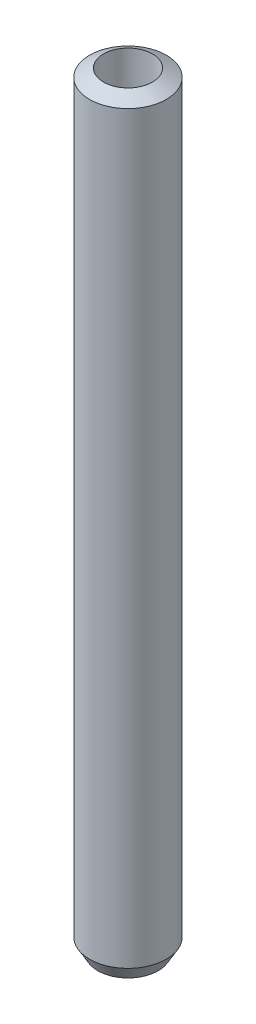
from build123d import *

# Parameters (mm, degrees)
SKETCH1_R           = 15
BOSS_EXTRUDE1_DEPTH = 299.717101
SKETCH2_R           = 9.555575494
CUT_EXTRUDE1_DEPTH  = 301.466871105
CHAMFER1_SIZE       = 3.18615
CHAMFER1_SIZE_2     = 5.518573


with BuildPart() as part:
    # Sketch1 → Boss-Extrude1 (new body)
    with BuildSketch(Plane(origin=(0, 0, 0), x_dir=(1, 0, 0), z_dir=(0, 1, 0))):
        with Locations(Location((0, 0, 0), (0, 0, 270))):
            Circle(SKETCH1_R)
    extrude(amount=BOSS_EXTRUDE1_DEPTH)

    # Sketch2 → Cut-Extrude1 (cut, through all)
    with BuildSketch(Plane(origin=(0, 0, 0), x_dir=(1, 0, 0), z_dir=(0, 1, 0))):
        with Locations(Location((0, 0, 0), (0, 0, 270))):
            Circle(SKETCH2_R)
    extrude(amount=CUT_EXTRUDE1_DEPTH, mode=Mode.SUBTRACT)

    # Chamfer1
    # the kernel refuses this chamfer: 5.518573, 3.18615 mm, written as the material it takes off along each edge
    with BuildSketch(Plane(origin=(0, 299.717101, 0), x_dir=(0, 0, 1), z_dir=(-1, 0, 0))) as chamfer1_piece_1:
        Polygon((15, -CHAMFER1_SIZE), (15 - CHAMFER1_SIZE_2, 0), (15, 0), align=None)
    revolve(axis=Axis((0, 299.717101, 0), (0, 1, 0)), mode=Mode.SUBTRACT)
    with BuildSketch(Plane(origin=(0, 0, 0), x_dir=(0, 0, 1), z_dir=(-1, 0, 0))) as chamfer1_piece_2:
        Polygon((15, CHAMFER1_SIZE_2), (15 - CHAMFER1_SIZE, 0), (15, 0), align=None)
    revolve(axis=Axis((0, 0, 0), (0, 1, 0)), mode=Mode.SUBTRACT)


solid = part.part
